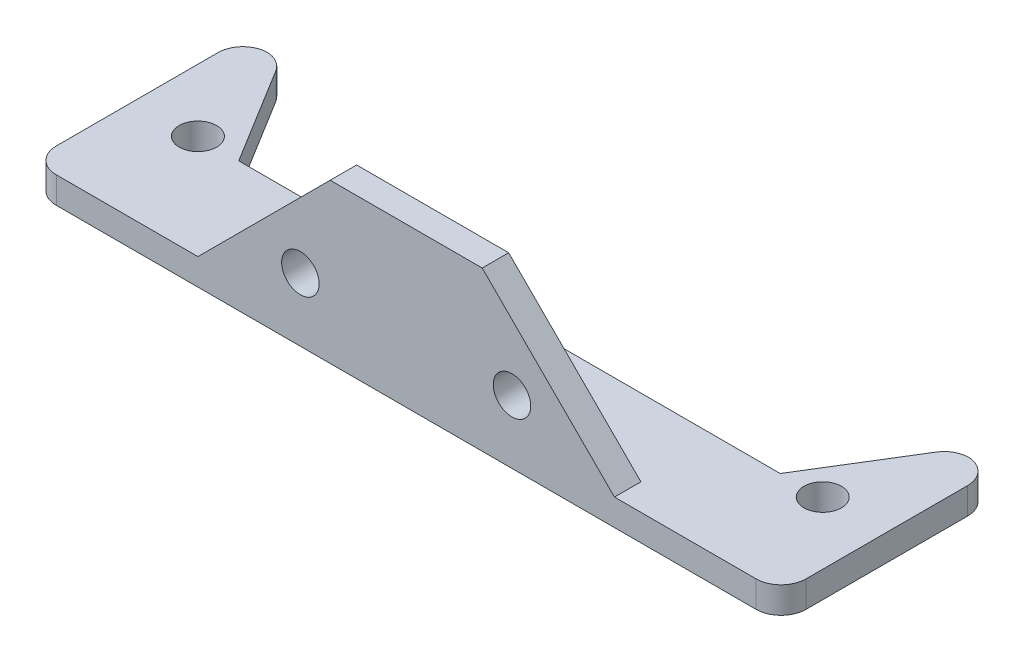
from build123d import *

# Parameters (mm, degrees)
BOSS_EXTRUDE1_DEPTH  = 25
CUT_EXTRUDE1_DEPTH   = 39.494845434
M4_CLEARANCE_HOLE1_D = 4.5
SKETCH5_W            = 25.4
SKETCH5_H            = 3.175
BOSS_EXTRUDE2_DEPTH  = 20
SKETCH6_W            = 25.4
SKETCH6_H            = 3.175
BOSS_EXTRUDE3_DEPTH  = 20
M4_CLEARANCE_HOLE2_D = 4.5
CUT_EXTRUDE2_DEPTH   = 55.05715147
FILLET1_R            = 3


with BuildPart() as part:
    # Sketch1 → Boss-Extrude1 (new, symmetric)
    with BuildSketch(Plane(origin=(0, 0, 0), x_dir=(0, 0, -1), z_dir=(1, 0, 0))):
        Polygon((0, 0), (0, -19.05), (25.4, -19.05), (25.4, -15.875), (3.175, -15.875), (3.175, 0), align=None)
    extrude(amount=BOSS_EXTRUDE1_DEPTH, both=True)

    # Sketch2 → Cut-Extrude1 (cut, through all)
    with BuildSketch(Plane(origin=(0, 0, -3.175), x_dir=(-1, 0, 0), z_dir=(0, 0, -1))):
        Polygon((-25, -15.875), (-9.125, 0), (-25, 0), align=None)
        Polygon((25, -15.875), (9.125, 0), (25, 0), align=None)
    extrude(amount=-CUT_EXTRUDE1_DEPTH, mode=Mode.SUBTRACT)

    # M4 Clearance Hole1 (through all)
    with Locations(Plane(origin=(0, 0, -3.175), x_dir=(-1, 0, 0), z_dir=(0, 0, -1))):
        with Locations((-12.7, -11.4453125), (12.7, -11.4453125)):
            Hole(M4_CLEARANCE_HOLE1_D / 2)

    # Sketch5 → Boss-Extrude2 (add)
    with BuildSketch(Plane(origin=(25, 0, 0), x_dir=(0, 0, -1), z_dir=(1, 0, 0))):
        with Locations((12.7, -17.4625)):
            Rectangle(SKETCH5_W, SKETCH5_H)
    extrude(amount=BOSS_EXTRUDE2_DEPTH)

    # Sketch6 → Boss-Extrude3 (add)
    with BuildSketch(Plane.ZY.offset(25)):
        with Locations((-12.7, -17.4625)):
            Rectangle(SKETCH6_W, SKETCH6_H)
    extrude(amount=BOSS_EXTRUDE3_DEPTH)

    # M4 Clearance Hole2 (through all)
    with Locations(Plane(origin=(0, -15.875, 0), x_dir=(1, 0, 0), z_dir=(0, 1, 0))):
        with Locations((37.5, 12.5), (-37.5, 12.5)):
            Hole(M4_CLEARANCE_HOLE2_D / 2)

    # Sketch9 → Cut-Extrude2 (cut, through all)
    with BuildSketch(Plane(origin=(0, -15.875, 0), x_dir=(1, 0, 0), z_dir=(0, 1, 0))):
        Polygon((40.5, 25.4), (-40.5, 25.4), (-32.5, 12.4), (32.5, 12.4), align=None)
    extrude(amount=-CUT_EXTRUDE2_DEPTH, mode=Mode.SUBTRACT)

    # Fillet1
    # the kernel refuses this fillet: 3 mm, written as the material it takes off along each edge
    with BuildSketch(Plane(origin=(-45, -26.55, -25.4), x_dir=(0, 0, 1), z_dir=(0, 1, 0)), Plane(origin=(45, -8.375, -25.4), x_dir=(0, 0, 1), z_dir=(0, -1, 0))) as fillet1_piece_1:
        with BuildLine():
            CenterArc((FILLET1_R, FILLET1_R), FILLET1_R, 180, 90)
            Line((0, FILLET1_R), (0, 0))
            Line((0, 0), (FILLET1_R, 0))
        make_face()
    extrude(amount=18.175, mode=Mode.SUBTRACT)
    with BuildSketch(Plane(origin=(-40.5, -11.684036045, -25.4), x_dir=(-1, 0, 0), z_dir=(0, -1, 0)), Plane(origin=(40.5, -11.684036045, -25.4), x_dir=(-0.5240974256643328, 0, 0.8516583167045451), z_dir=(0, -1, 0))) as fillet1_piece_2:
        with BuildLine():
            CenterArc((FILLET1_R * 0.558795194036, -FILLET1_R), FILLET1_R, 90, 58.392497754)
            Line((-FILLET1_R * 0.292863122668, -FILLET1_R * 0.475902574336), (0, 0))
            Line((0, 0), (FILLET1_R * 0.558795194036, 0))
        make_face()
    extrude(amount=11.556927911, mode=Mode.SUBTRACT)
    with BuildSketch(Plane(origin=(45, -26.55, 0), x_dir=(-1, 0, 0), z_dir=(0, 1, 0)), Plane(origin=(-45, -8.375, 0), x_dir=(1, 0, 0), z_dir=(0, -1, 0))) as fillet1_piece_3:
        with BuildLine():
            CenterArc((FILLET1_R, -FILLET1_R), FILLET1_R, 90, 90)
            Line((0, -FILLET1_R), (0, 0))
            Line((0, 0), (FILLET1_R, 0))
        make_face()
    extrude(amount=18.175, mode=Mode.SUBTRACT)


solid = part.part
